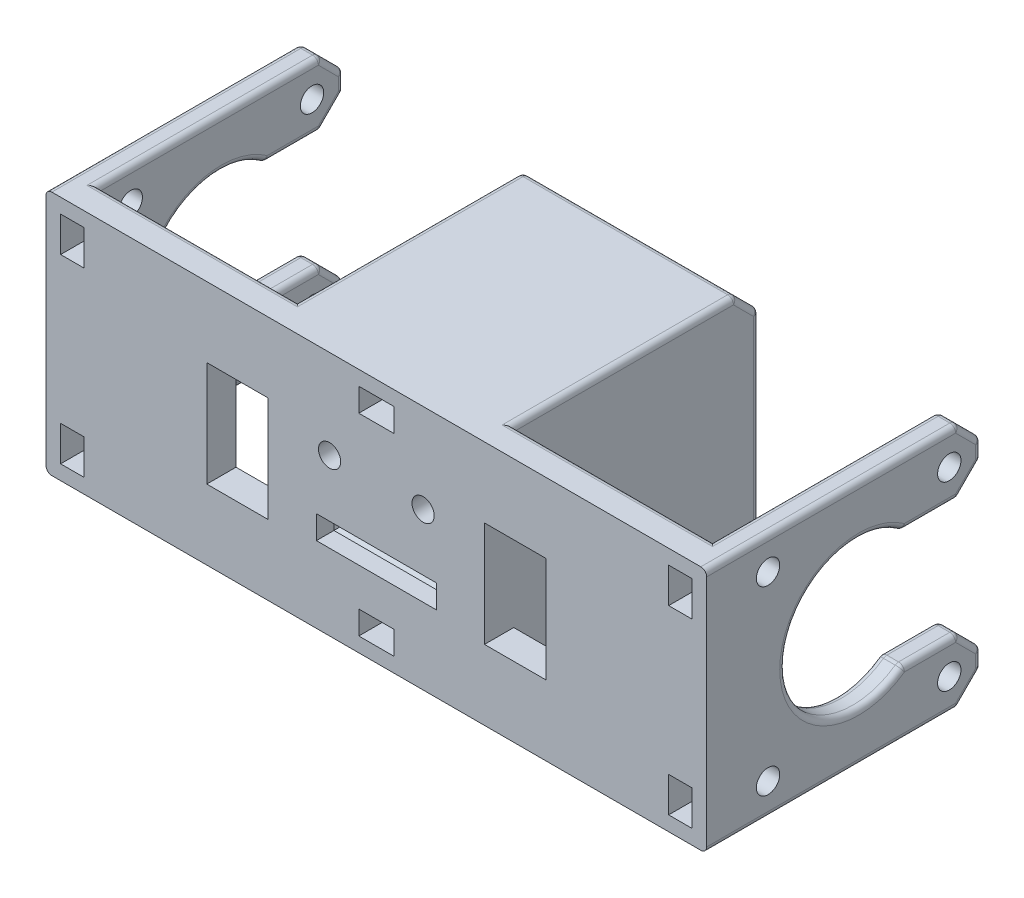
from build123d import *

# Parameters (mm, degrees)
ESQUISSE1_W             = 105
ESQUISSE1_H             = 42
ESQUISSE1_W_2           = 10.5
ESQUISSE1_H_2           = 18
BOSS_EXTRU_1_DEPTH      = 5
ESQUISSE2_W             = 37
ESQUISSE2_H             = 42
BOSS_EXTRU_2_DEPTH      = 42
CHANFREIN1_SIZE         = 4
ESQUISSE3_R             = 2
BOSS_EXTRU_3_DEPTH      = 4
BOSS_EXTRU_4_START      = -109
ESQUISSE3_2_R           = 2
BOSS_EXTRU_4_DEPTH      = 4
CHANFREIN2_SIZE         = 4
ESQUISSE4_R             = 1.9
ENL_V_MAT_EXTRU_1_DEPTH = 12
ESQUISSE5_W             = 20.5
ESQUISSE5_H             = 4
ENL_V_MAT_EXTRU_2_DEPTH = 4
ESQUISSE6_W             = 4
ESQUISSE6_H             = 6
ENL_V_MAT_EXTRU_3_DEPTH = 5
ESQUISSE9_W             = 6
ESQUISSE9_H             = 4
ENL_V_MAT_EXTRU_6_DEPTH = 7
CONG_1_R                = 1
CONG_2_R                = 1
CHANFREIN3_SIZE         = 1.5
CHANFREIN4_SIZE         = 1
CHANFREIN5_SIZE         = 1.5
CHANFREIN6_SIZE         = 1.5


with BuildPart() as part:
    # Esquisse1 → Boss.-Extru.1 (new body)
    with BuildSketch(Plane.XY):
        with Locations((52.5, 21)):
            Rectangle(ESQUISSE1_W, ESQUISSE1_H)
        with Locations((28.75, 21)):
            Rectangle(ESQUISSE1_W_2, ESQUISSE1_H_2, mode=Mode.SUBTRACT)
        with Locations((76.25, 21)):
            Rectangle(ESQUISSE1_W_2, ESQUISSE1_H_2, mode=Mode.SUBTRACT)
    extrude(amount=BOSS_EXTRU_1_DEPTH)

    # Esquisse2 → Boss.-Extru.2 (add)
    with BuildSketch(Plane(origin=(0, 0, 0), x_dir=(-1, 0, 0), z_dir=(0, 0, -1))):
        with Locations((-52.5, 21)):
            Rectangle(ESQUISSE2_W, ESQUISSE2_H)
    extrude(amount=BOSS_EXTRU_2_DEPTH)

    # Chanfrein1
    chanfrein1_edges = [part.edges().sort_by_distance(p)[0] for p in [
        (52.5, 0, -42),
        (52.5, 42, -42),
    ]]
    chamfer(chanfrein1_edges, length=CHANFREIN1_SIZE)

    # Esquisse3 → Boss.-Extru.3 (add)
    with BuildSketch(Plane(origin=(105, 0, 0), x_dir=(0, 0, -1), z_dir=(1, 0, 0))):
        with BuildLine():
            Line((-5, 0), (42, 0))
            Line((42, 0), (42, 11))
            Line((42, 11), (28.5, 11))
            ThreePointArc((28.5, 11), (8.5, 21), (28.5, 31))
            Line((28.5, 31), (42, 31))
            Line((42, 31), (42, 42))
            Line((42, 42), (-5, 42))
            Line((-5, 42), (-5, 0))
        make_face()
        with Locations((36.5, 36.5)):
            Circle(ESQUISSE3_R, mode=Mode.SUBTRACT)
        with Locations((36.5, 5.5)):
            Circle(ESQUISSE3_R, mode=Mode.SUBTRACT)
        with Locations((5.5, 5.5)):
            Circle(ESQUISSE3_R, mode=Mode.SUBTRACT)
        with Locations((5.5, 36.5)):
            Circle(ESQUISSE3_R, mode=Mode.SUBTRACT)
    extrude(amount=BOSS_EXTRU_3_DEPTH)

    # Esquisse3<2> → Boss.-Extru.4 (add)
    with BuildSketch(Plane(origin=(105, 0, 0), x_dir=(0, 0, -1), z_dir=(1, 0, 0)).offset(BOSS_EXTRU_4_START)):
        with BuildLine():
            Line((-5, 0), (42, 0))
            Line((42, 0), (42, 11))
            Line((42, 11), (28.5, 11))
            ThreePointArc((28.5, 11), (8.5, 21), (28.5, 31))
            Line((28.5, 31), (42, 31))
            Line((42, 31), (42, 42))
            Line((42, 42), (-5, 42))
            Line((-5, 42), (-5, 0))
        make_face()
        with Locations((36.5, 36.5)):
            Circle(ESQUISSE3_2_R, mode=Mode.SUBTRACT)
        with Locations((36.5, 5.5)):
            Circle(ESQUISSE3_2_R, mode=Mode.SUBTRACT)
        with Locations((5.5, 5.5)):
            Circle(ESQUISSE3_2_R, mode=Mode.SUBTRACT)
        with Locations((5.5, 36.5)):
            Circle(ESQUISSE3_2_R, mode=Mode.SUBTRACT)
    extrude(amount=BOSS_EXTRU_4_DEPTH)

    # Chanfrein2
    chanfrein2_edges = [part.edges().sort_by_distance(p)[0] for p in [
        (-2, 11, -42),
        (-2, 0, -42),
        (-2, 42, -42),
        (-2, 31, -42),
        (107, 31, -42),
        (107, 42, -42),
        (107, 0, -42),
        (107, 11, -42),
    ]]
    chamfer(chanfrein2_edges, length=CHANFREIN2_SIZE)

    # Esquisse4 → Enlèv. mat.-Extru.1 (cut)
    with BuildSketch(Plane.XY.offset(5)):
        with Locations((44.5, 26.75)):
            Circle(ESQUISSE4_R)
        with Locations((60.5, 26.75)):
            Circle(ESQUISSE4_R)
    extrude(amount=-ENL_V_MAT_EXTRU_1_DEPTH, mode=Mode.SUBTRACT)

    # Esquisse5 → Enlèv. mat.-Extru.2 (cut)
    with BuildSketch(Plane.XY.offset(5)):
        with Locations((52.5, 15)):
            Rectangle(ESQUISSE5_W, ESQUISSE5_H)
    extrude(amount=-ENL_V_MAT_EXTRU_2_DEPTH, mode=Mode.SUBTRACT)

    # Esquisse6 → Enlèv. mat.-Extru.3 (cut)
    with BuildSketch(Plane.XY.offset(5)):
        with Locations((0.5, 5.5)):
            Rectangle(ESQUISSE6_W, ESQUISSE6_H)
        with Locations((0.5, 36.5)):
            Rectangle(ESQUISSE6_W, ESQUISSE6_H)
    enl_v_mat_extru_3 = extrude(amount=-ENL_V_MAT_EXTRU_3_DEPTH, mode=Mode.SUBTRACT)

    # Esquisse9 → Enlèv. mat.-Extru.6 (cut)
    with BuildSketch(Plane.XY.offset(5)):
        with Locations((52.5, 37.5)):
            Rectangle(ESQUISSE9_W, ESQUISSE9_H)
        with Locations((52.5, 4.5)):
            Rectangle(ESQUISSE9_W, ESQUISSE9_H)
    extrude(amount=-ENL_V_MAT_EXTRU_6_DEPTH, mode=Mode.SUBTRACT)

    # Congé1
    cong_1_edges = [part.edges().sort_by_distance(p)[0] for p in [
        (-2, 31, -28.5),
        (-2, 11, -28.5),
        (107, 0, -38),
        (-2, 0, -38),
        (-2, 7, -42),
        (-2, 4, -42),
        (-2, 11, -38),
        (-2, 31, -38),
        (-2, 38, -42),
        (-2, 35, -42),
        (107, 42, -38),
        (-2, 42, -38),
        (107, 11, -38),
        (107, 4, -42),
        (107, 7, -42),
        (107, 38, -42),
        (107, 35, -42),
        (107, 31, -38),
        (52.5, 38, -42),
        (52.5, 4, -42),
        (52.5, 0, -38),
        (52.5, 42, -38),
        (107, 11, -28.5),
        (107, 31, -28.5),
    ]]
    fillet(cong_1_edges, radius=CONG_1_R)

    # Congé2
    cong_2_edges = [part.edges().sort_by_distance(p)[0] for p in [
        (-4, 0, -16.292893219),
        (0, 0, -18.792893219),
        (0, 21, -8.5),
        (-4, 21, -8.5),
        (0, 2, -40),
        (0, 5.5, -42),
        (0, 9, -40),
        (0, 11, -33.206012179),
        (0, 31, -33.206012179),
        (0, 33, -40),
        (0, 36.5, -42),
        (0, 40, -40),
        (0, 42, -18.792893219),
        (0, 0.076120467, -37.96846987),
        (0, 4.03153013, -41.923879533),
        (0, 6.96846987, -41.923879533),
        (0, 10.923879533, -37.96846987),
        (0, 10.952579344, -28.521947612),
        (0, 35.03153013, -41.923879533),
        (0, 37.96846987, -41.923879533),
        (0, 41.923879533, -37.96846987),
        (0, 31.076120467, -37.96846987),
        (0, 31.047420656, -28.521947612),
        (-4, 31, -33.206012179),
        (-4, 5.5, -42),
        (-4, 2, -40),
        (-4, 42, -16.292893219),
        (-4, 40, -40),
        (-4, 36.5, -42),
        (-4, 33, -40),
        (-4, 11, -33.206012179),
        (-4, 9, -40),
        (-4, 0.076120467, -37.96846987),
        (-4, 4.03153013, -41.923879533),
        (-4, 6.96846987, -41.923879533),
        (-4, 10.923879533, -37.96846987),
        (-4, 10.952579344, -28.521947612),
        (-4, 35.03153013, -41.923879533),
        (-4, 37.96846987, -41.923879533),
        (-4, 41.923879533, -37.96846987),
        (-4, 31.076120467, -37.96846987),
        (-4, 31.047420656, -28.521947612),
        (109, 42, -16.292893219),
        (105, 42, -18.792893219),
        (71, 42, -18.792893219),
        (34, 42, -18.792893219),
        (34, 0, -18.792893219),
        (71, 0, -18.792893219),
        (71, 21, -42),
        (34, 21, -42),
        (71, 2, -40),
        (71, 40, -40),
        (71, 0.076120467, -37.96846987),
        (71, 4.03153013, -41.923879533),
        (71, 41.923879533, -37.96846987),
        (71, 37.96846987, -41.923879533),
        (34, 40, -40),
        (34, 2, -40),
        (34, 0.076120467, -37.96846987),
        (34, 4.03153013, -41.923879533),
        (34, 41.923879533, -37.96846987),
        (34, 37.96846987, -41.923879533),
        (109, 5.5, -42),
        (109, 9, -40),
        (109, 11, -33.206012179),
        (109, 21, -8.5),
        (109, 31, -33.206012179),
        (109, 33, -40),
        (109, 36.5, -42),
        (109, 40, -40),
        (109, 2, -40),
        (109, 31.076120467, -37.96846987),
        (109, 31.047420656, -28.521947612),
        (109, 35.03153013, -41.923879533),
        (109, 37.96846987, -41.923879533),
        (109, 41.923879533, -37.96846987),
        (109, 10.923879533, -37.96846987),
        (109, 10.952579344, -28.521947612),
        (109, 6.96846987, -41.923879533),
        (109, 4.03153013, -41.923879533),
        (109, 0.076120467, -37.96846987),
        (105, 2, -40),
        (105, 11, -33.206012179),
        (105, 9, -40),
        (105, 5.5, -42),
        (105, 40, -40),
        (105, 36.5, -42),
        (105, 33, -40),
        (105, 31, -33.206012179),
        (105, 21, -8.5),
        (105, 31.076120467, -37.96846987),
        (105, 31.047420656, -28.521947612),
        (105, 35.03153013, -41.923879533),
        (105, 37.96846987, -41.923879533),
        (105, 41.923879533, -37.96846987),
        (105, 10.923879533, -37.96846987),
        (105, 10.952579344, -28.521947612),
        (105, 6.96846987, -41.923879533),
        (105, 4.03153013, -41.923879533),
        (105, 0.076120467, -37.96846987),
        (17, 42, 0),
        (88, 0, 0),
        (88, 42, 0),
        (17, 0, 0),
        (109, 0, -16.292893219),
        (105, 0, -18.792893219),
    ]]
    fillet(cong_2_edges, radius=CONG_2_R)

    # Chanfrein3
    chanfrein3_edges = [part.edges().sort_by_distance(p)[0] for p in [
        (42.6, 26.75, -7),
        (58.6, 26.75, -7),
    ]]
    chamfer(chanfrein3_edges, length=CHANFREIN3_SIZE)

    # Chanfrein4
    chanfrein4_edges = [part.edges().sort_by_distance(p)[0] for p in [
        (42.25, 15, 1),
        (52.5, 17, 1),
        (62.75, 15, 1),
        (52.5, 13, 1),
    ]]
    chamfer(chanfrein4_edges, length=CHANFREIN4_SIZE)

    # Chanfrein5
    chanfrein5_edges = [part.edges().sort_by_distance(p)[0] for p in [
        (49.5, 37.5, -2),
        (52.5, 39.5, -2),
        (55.5, 37.5, -2),
        (52.5, 35.5, -2),
        (49.5, 4.5, -2),
        (52.5, 6.5, -2),
        (55.5, 4.5, -2),
        (52.5, 2.5, -2),
    ]]
    chamfer(chanfrein5_edges, length=CHANFREIN5_SIZE)

    # Symétrie2: Enlèv. mat.-Extru.3 across plane
    add(enl_v_mat_extru_3.mirror(Plane(origin=(52.5, 0, 0), x_dir=(0, 0, 1), z_dir=(1, 0, 0))), mode=Mode.SUBTRACT)

    # Chanfrein6
    # the kernel refuses this chamfer: 1.5 mm, written as the material it takes off along each edge
    with BuildSketch(Plane(origin=(0, 39.5, 0), x_dir=(-0.9996219169112969, 0, 0.02749587661058637), z_dir=(0, -1, 0)), Plane(origin=(0, 8.5, 0), x_dir=(-0.9996219169112968, 0, 0.027495876610586372), z_dir=(0, -1, 0)), Plane(origin=(105, 2.5, 0), x_dir=(0.9996219169112968, 0, 0.027495876610586487), z_dir=(0, 1, 0)), Plane(origin=(105, 33.5, 0), x_dir=(0.9996219169112968, 0, 0.027495876610586487), z_dir=(0, 1, 0))) as chanfrein6_piece_1:
        Polygon((CHANFREIN6_SIZE * 0.999621916911, CHANFREIN6_SIZE * 0.0274958766106), (-CHANFREIN6_SIZE * 0.0274958766106, CHANFREIN6_SIZE * 0.999621916911), (0, 0), align=None)
    extrude(amount=6, mode=Mode.SUBTRACT)


solid = part.part
